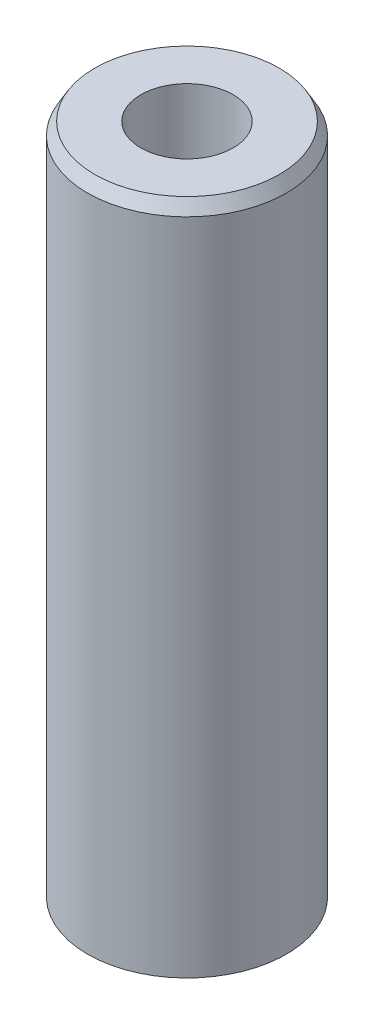
from build123d import *
from OCP.BRepFilletAPI import BRepFilletAPI_MakeChamfer

# Parameters (mm, degrees)
SKETCH1_R           = 35
BOSS_EXTRUDE1_DEPTH = 238.964466787
SKETCH2_R           = 16.244650141
CUT_EXTRUDE1_DEPTH  = 245.036916033
CHAMFER1_SIZE       = 4.390692477
CHAMFER1_SIZE2      = 2.534967484


with BuildPart() as part:
    # Sketch1 → Boss-Extrude1 (new body)
    with BuildSketch(Plane(origin=(0, 0, 0), x_dir=(1, 0, 0), z_dir=(0, 1, 0))):
        Circle(SKETCH1_R)
    extrude(amount=BOSS_EXTRUDE1_DEPTH)

    # Sketch2 → Cut-Extrude1 (cut, through all)
    with BuildSketch(Plane(origin=(0, 0, 0), x_dir=(1, 0, 0), z_dir=(0, 1, 0))):
        Circle(SKETCH2_R)
    extrude(amount=CUT_EXTRUDE1_DEPTH, mode=Mode.SUBTRACT)

    # Chamfer1: one chamfer whose edges measure the first distance from different faces: ONE call of the kernel's chamfer builder (chamfer() names one face for all edges)
    chamfer1_edges_1 = [part.edges().sort_by_distance(p)[0] for p in [
        (-35, 238.964466787, 0),
    ]]
    chamfer1_side_1 = [part.faces().sort_by_distance(p)[0] for p in [
        (-35, 119.482233393, 0),
    ]]
    chamfer1_edges_2 = [part.edges().sort_by_distance(p)[0] for p in [
        (-35, 0, 0),
    ]]
    chamfer1_side_2 = [part.faces().sort_by_distance(p)[0] for p in [
        (-34.010050506, 0, 0),
    ]]
    chamfer1 = BRepFilletAPI_MakeChamfer(part.part.solid().wrapped)
    for e in chamfer1_edges_1:
        chamfer1.Add(CHAMFER1_SIZE, CHAMFER1_SIZE2, e.wrapped, chamfer1_side_1[0].wrapped)  # the first distance lies on this face
    for e in chamfer1_edges_2:
        chamfer1.Add(CHAMFER1_SIZE, CHAMFER1_SIZE2, e.wrapped, chamfer1_side_2[0].wrapped)  # the first distance lies on this face
    add(Compound.cast(chamfer1.Shape()), mode=Mode.REPLACE)


solid = part.part
